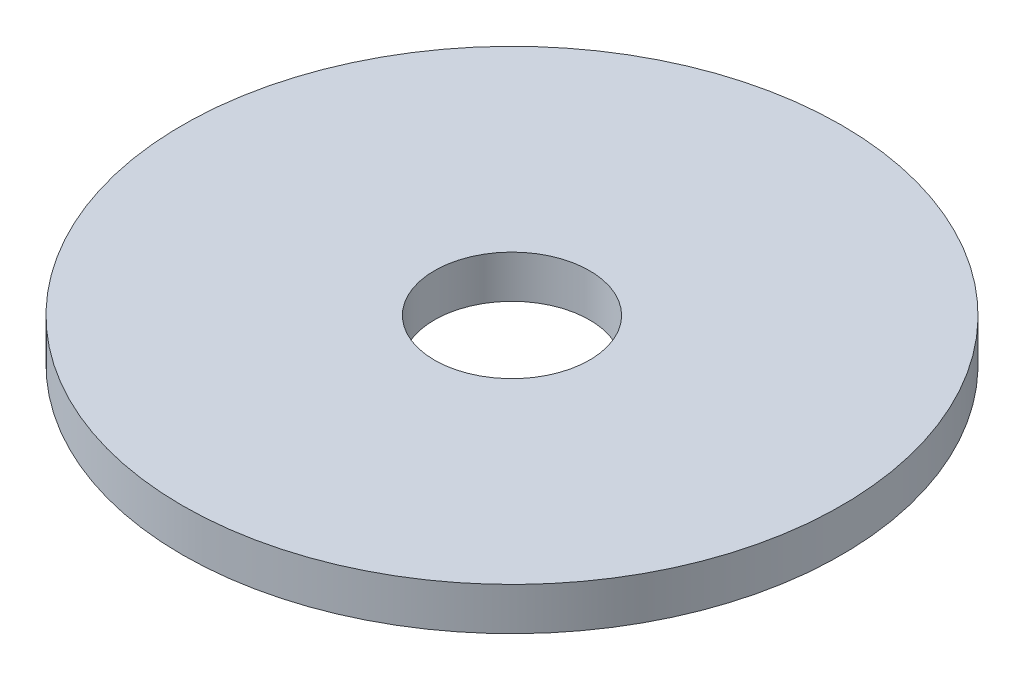
from build123d import *

# Parameters (mm, degrees)
SKETCH1_R           = 85
BOSS_EXTRUDE1_DEPTH = 11
SKETCH2_R           = 20
CUT_EXTRUDE1_DEPTH  = 121.710397232


with BuildPart() as part:
    # Sketch1 → Boss-Extrude1 (new body)
    with BuildSketch(Plane(origin=(0, 0, 0), x_dir=(1, 0, 0), z_dir=(0, 1, 0))):
        Circle(SKETCH1_R)
    extrude(amount=BOSS_EXTRUDE1_DEPTH)

    # Sketch2 → Cut-Extrude1 (cut, through all)
    with BuildSketch(Plane(origin=(0, 0, 0), x_dir=(1, 0, 0), z_dir=(0, 1, 0))):
        Circle(SKETCH2_R)
    extrude(amount=CUT_EXTRUDE1_DEPTH, mode=Mode.SUBTRACT)


solid = part.part
